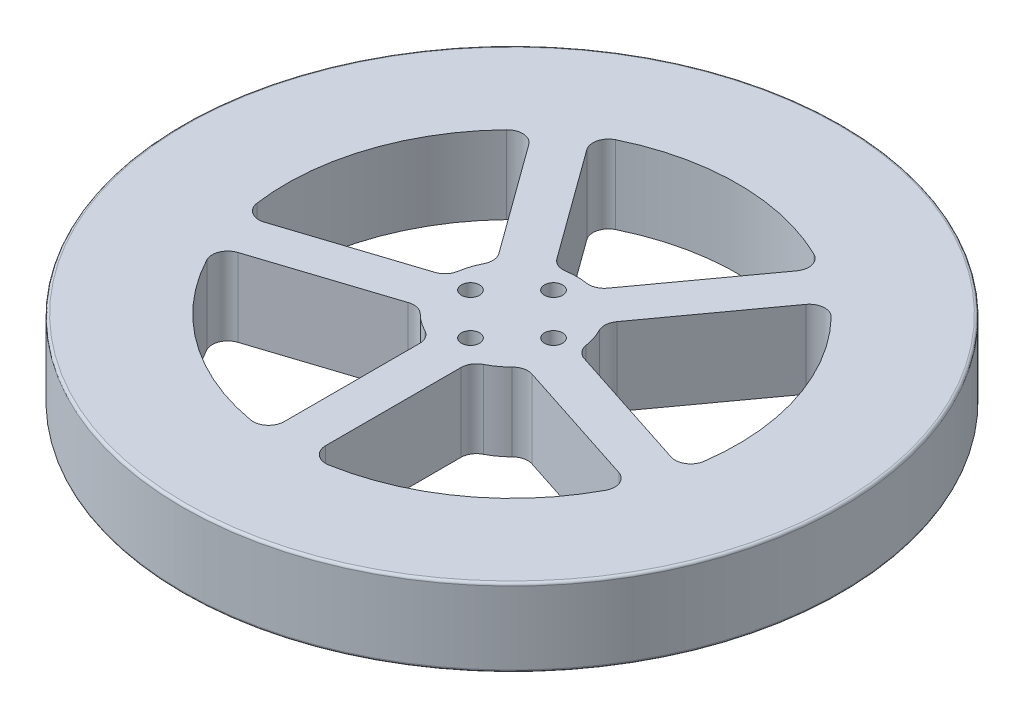
from build123d import *

# Parameters (mm, degrees)
SKETCH2_R           = 63.5
BOSS_EXTRUDE1_DEPTH = 15
SKETCH3_R           = 1.75
CUT_EXTRUDE1_DEPTH  = 92.046691318
FILLET2_R           = 0.5
CUT_EXTRUDE3_REACH  = 93.047
FILLET3_R           = 3


with BuildPart() as part:
    # Sketch2 → Boss-Extrude1 (new body)
    with BuildSketch(Plane(origin=(0, 0, 0), x_dir=(1, 0, 0), z_dir=(0, 1, 0))):
        Circle(SKETCH2_R)
    extrude(amount=BOSS_EXTRUDE1_DEPTH)

    # Sketch3 → Cut-Extrude1 (cut, through all)
    with BuildSketch(Plane(origin=(0, 15, 0), x_dir=(1, 0, 0), z_dir=(0, 1, 0))):
        with Locations((0, 8)):
            Circle(SKETCH3_R)
        with Locations((8, 0)):
            Circle(SKETCH3_R)
        with Locations((0, -8)):
            Circle(SKETCH3_R)
        with Locations((-8, 0)):
            Circle(SKETCH3_R)
    extrude(amount=-CUT_EXTRUDE1_DEPTH, mode=Mode.SUBTRACT)

    # Fillet2
    fillet2_edges = [part.edges().sort_by_distance(p)[0] for p in [
        (-63.5, 15, 0),
        (-63.5, 0, 0),
    ]]
    fillet(fillet2_edges, radius=FILLET2_R)

    # Sketch5 → Cut-Extrude3 (cut, up to next)
    with BuildSketch(Plane.XZ, mode=Mode.PRIVATE) as cut_extrude3_sk1:
        with BuildLine():
            ThreePointArc((-10.027027367, 7.463827583), (-7.347315654, 10.11271243), (-4, 11.842719282))
            Line((-4, 11.842719282), (-4, 43.315701541))
            ThreePointArc((-4, 43.315701541), (-25.568658475, 35.192239255), (-39.959612231, 17.189513965))
            Line((-39.959612231, 17.189513965), (-10.027027367, 7.463827583))
        make_face()
    cut_extrude3_tool1 = extrude(cut_extrude3_sk1.sketch, amount=-CUT_EXTRUDE3_REACH, mode=Mode.PRIVATE) & part.part
    # Sketch5 → Cut-Extrude3 (cut, up to next)
    with BuildSketch(Plane.XZ, mode=Mode.PRIVATE) as cut_extrude3_sk2:
        with BuildLine():
            Line((4, 43.315701541), (4, 11.842719282))
            ThreePointArc((4, 11.842719282), (7.347315654, 10.11271243), (10.027027367, 7.463827583))
            Line((10.027027367, 7.463827583), (39.959612231, 17.189513965))
            ThreePointArc((39.959612231, 17.189513965), (25.568658475, 35.192239255), (4, 43.315701541))
        make_face()
    cut_extrude3_tool2 = extrude(cut_extrude3_sk2.sketch, amount=-CUT_EXTRUDE3_REACH, mode=Mode.PRIVATE) & part.part
    # Sketch5 → Cut-Extrude3 (cut, up to next)
    with BuildSketch(Plane.XZ, mode=Mode.PRIVATE) as cut_extrude3_sk3:
        with BuildLine():
            Line((42.431748186, 9.581061834), (12.499163322, -0.144624547))
            ThreePointArc((12.499163322, -0.144624547), (11.888206454, -3.86271243), (10.197043719, -7.22982015))
            Line((10.197043719, -7.22982015), (28.696398536, -32.691997661))
            ThreePointArc((28.696398536, -32.691997661), (41.370958459, -13.442239255), (42.431748186, 9.581061834))
        make_face()
    cut_extrude3_tool3 = extrude(cut_extrude3_sk3.sketch, amount=-CUT_EXTRUDE3_REACH, mode=Mode.PRIVATE) & part.part
    # Sketch5 → Cut-Extrude3 (cut, up to next)
    with BuildSketch(Plane.XZ, mode=Mode.PRIVATE) as cut_extrude3_sk4:
        with BuildLine():
            Line((22.224262581, -37.394279679), (3.724907764, -11.932102168))
            ThreePointArc((3.724907764, -11.932102168), (0, -12.5), (-3.724907764, -11.932102168))
            Line((-3.724907764, -11.932102168), (-22.224262581, -37.394279679))
            ThreePointArc((-22.224262581, -37.394279679), (0, -43.5), (22.224262581, -37.394279679))
        make_face()
    cut_extrude3_tool4 = extrude(cut_extrude3_sk4.sketch, amount=-CUT_EXTRUDE3_REACH, mode=Mode.PRIVATE) & part.part
    # Sketch5 → Cut-Extrude3 (cut, up to next)
    with BuildSketch(Plane.XZ, mode=Mode.PRIVATE) as cut_extrude3_sk5:
        with BuildLine():
            Line((-28.696398536, -32.691997661), (-10.197043719, -7.22982015))
            ThreePointArc((-10.197043719, -7.22982015), (-11.888206454, -3.86271243), (-12.499163322, -0.144624547))
            Line((-12.499163322, -0.144624547), (-42.431748186, 9.581061834))
            ThreePointArc((-42.431748186, 9.581061834), (-41.370958459, -13.442239255), (-28.696398536, -32.691997661))
        make_face()
    cut_extrude3_tool5 = extrude(cut_extrude3_sk5.sketch, amount=-CUT_EXTRUDE3_REACH, mode=Mode.PRIVATE) & part.part
    add(cut_extrude3_tool1.solids().sort_by_distance((-17.865748, 0, 24.590092))[0], mode=Mode.SUBTRACT)
    add(cut_extrude3_tool2.solids().sort_by_distance((17.865748, 0, 24.590092))[0], mode=Mode.SUBTRACT)
    add(cut_extrude3_tool3.solids().sort_by_distance((28.907387, 0, -9.392579))[0], mode=Mode.SUBTRACT)
    add(cut_extrude3_tool4.solids().sort_by_distance((0, 0, -30.395026))[0], mode=Mode.SUBTRACT)
    add(cut_extrude3_tool5.solids().sort_by_distance((-28.907387, 0, -9.392579))[0], mode=Mode.SUBTRACT)

    # Fillet3
    fillet3_edges = [part.edges().sort_by_distance(p)[0] for p in [
        (42.431748186, 7.5, 9.581061834),
        (12.499163322, 7.5, -0.144624547),
        (10.197043719, 7.5, -7.22982015),
        (28.696398536, 7.5, -32.691997661),
        (-42.431748186, 7.5, 9.581061834),
        (-39.959612231, 7.5, 17.189513965),
        (-4, 7.5, 43.315701541),
        (4, 7.5, 43.315701541),
        (-10.027027367, 7.5, 7.463827583),
        (4, 7.5, 11.842719282),
        (10.027027367, 7.5, 7.463827583),
        (-28.696398536, 7.5, -32.691997661),
        (3.724907764, 7.5, -11.932102168),
        (-3.724907764, 7.5, -11.932102168),
        (-22.224262581, 7.5, -37.394279679),
        (-10.197043719, 7.5, -7.22982015),
        (-12.499163322, 7.5, -0.144624547),
        (-4, 7.5, 11.842719282),
        (39.959612231, 7.5, 17.189513965),
        (22.224262581, 7.5, -37.394279679),
    ]]
    fillet(fillet3_edges, radius=FILLET3_R)


solid = part.part
